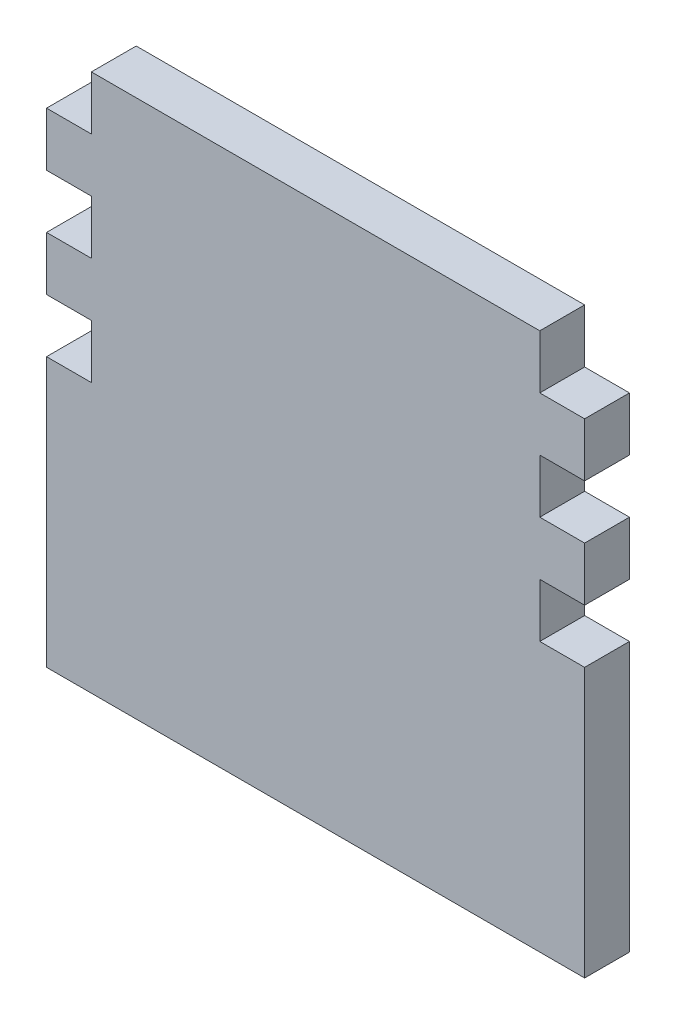
from build123d import *

# Parameters (mm, degrees)
SKETCH1_W           = 76.2
SKETCH1_H           = 76.2
BOSS_EXTRUDE1_DEPTH = 6.35
CUT_EXTRUDE1_DEPTH  = 6.35


with BuildPart() as part:
    # Sketch1 → Boss-Extrude1 (new body)
    with BuildSketch(Plane.XY):
        with Locations((0.21991342, -21.056709957)):
            Rectangle(SKETCH1_W, SKETCH1_H)
    extrude(amount=BOSS_EXTRUDE1_DEPTH)

    # Sketch2 → Cut-Extrude1 (cut)
    with BuildSketch(Plane.XY.offset(6.35)):
        Polygon((-37.88008658, 17.043290043), (-31.53008658, 17.043290043), (-31.53008658, 9.423290043), (-37.88008658, 9.423290043), (-37.88008658, 1.803290043), (-31.53008658, 1.803290043), (-31.53008658, -5.816709957), (-37.88008658, -5.816709957), (-37.88008658, -13.436709957), (-31.53008658, -13.436709957), (-31.53008658, -21.056709957), (-37.88008658, -21.056709957), (-46.725849744, -21.056709957), (-46.725849744, 17.043290043), align=None)
        Polygon((47.165676584, -21.056709957), (47.165676584, 17.043290043), (38.31991342, 17.043290043), (31.96991342, 17.043290043), (31.96991342, 9.423290043), (38.31991342, 9.423290043), (38.31991342, 1.803290043), (31.96991342, 1.803290043), (31.96991342, -5.816709957), (38.31991342, -5.816709957), (38.31991342, -13.436709957), (31.96991342, -13.436709957), (31.96991342, -21.056709957), (38.31991342, -21.056709957), align=None)
    extrude(amount=-CUT_EXTRUDE1_DEPTH, mode=Mode.SUBTRACT)


solid = part.part
